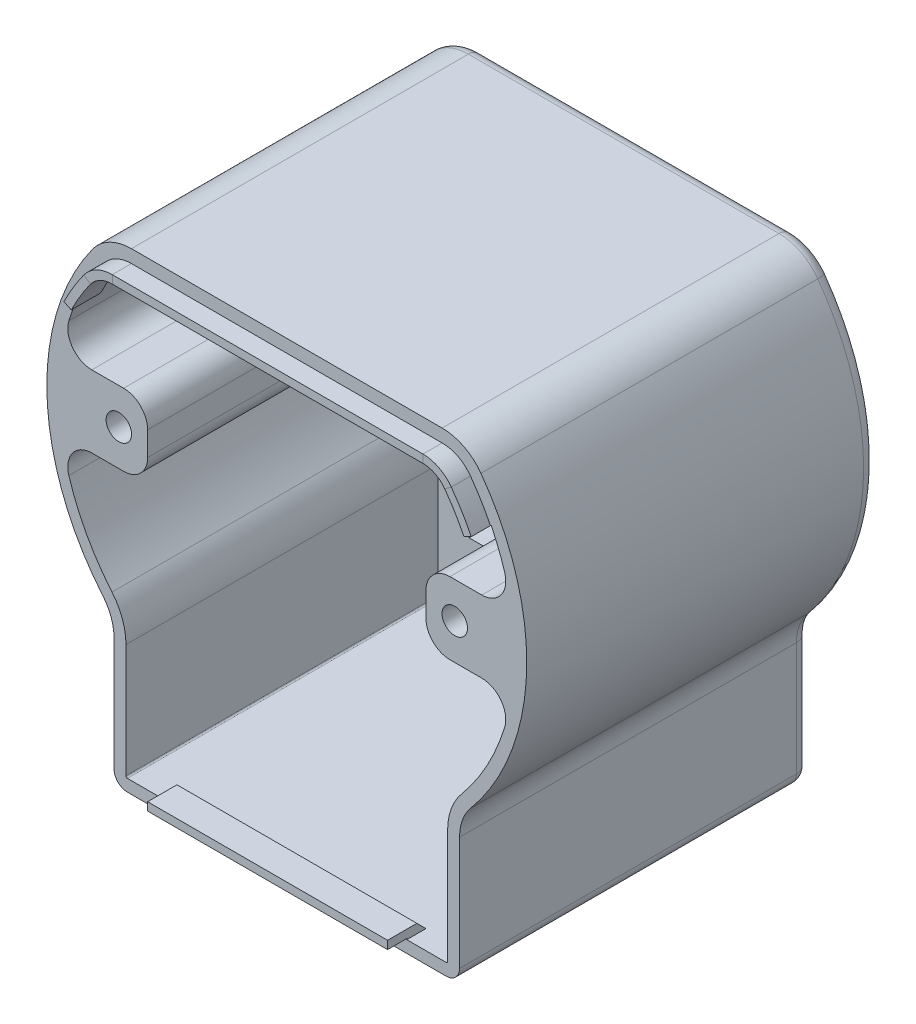
from build123d import *

# Parameters (mm, degrees)
LINEAR_AUSTRAGEN_D_NN1_DEPTH         = 65
AUFSATZ_LINEAR_START                 = 8
AUFSATZ_LINEAR_AUSTRAGEN2_DEPTH      = 8
AUFSATZ_LINEAR_AUSTRAGEN3_REACH      = 135.642
AUFSATZ_LINEAR_AUSTRAGEN3_END_RADIUS = 47.51
AUFSATZ_LINEAR_START_2               = 29
SKIZZE6_W                            = 65
SKIZZE6_H                            = 15
AUFSATZ_LINEAR_AUSTRAGEN4_REACH      = 135.642
AUFSATZ_LINEAR_START_3               = -29
SKIZZE6_2_W                          = 65
SKIZZE6_2_H                          = 15
SCHNITT_LINEAR_AUSTRAGEN2_REACH      = 111.791
SKIZZE7_R                            = 2.65
SCHNITT_LINEAR_AUSTRAGEN3_REACH      = 116.791
SCHNITT_LINEAR_START                 = -5
SKIZZE8_R                            = 4.5
AUFSATZ_LINEAR_AUSTRAGEN6_DEPTH      = 25
VERRUNDUNG1_R                        = 5
VERRUNDUNG3_R                        = 2.8


with BuildPart() as part:
    # Skizze1 → Linear-Austragen-Dünn1 (new body)
    with BuildSketch(Plane.XY):
        with BuildLine():
            Line((-33.2, -65), (0, -65))
            Line((0, -65), (33.2, -65))
            ThreePointArc((33.2, -65), (35.179898987, -64.179898987), (36, -62.2))
            Line((36, -62.2), (36, -38.522720569))
            ThreePointArc((36, -38.522720569), (36.601418547, -35.107070313), (38.333333333, -32.10226714))
            ThreePointArc((38.333333333, -32.10226714), (49.970076451, -1.729583607), (40.461208274, 29.375))
            ThreePointArc((40.461208274, 29.375), (36.91044215, 32.409264841), (32.368966619, 33.5))
            Line((32.368966619, 33.5), (0, 33.5))
            Line((0, 33.5), (-32.368966619, 33.5))
            ThreePointArc((-32.368966619, 33.5), (-36.91044215, 32.409264841), (-40.461208274, 29.375))
            ThreePointArc((-40.461208274, 29.375), (-49.970076451, -1.729583607), (-38.333333333, -32.10226714))
            ThreePointArc((-38.333333333, -32.10226714), (-36.601418547, -35.107070313), (-36, -38.522720569))
            Line((-36, -38.522720569), (-36, -62.2))
            ThreePointArc((-36, -62.2), (-35.179898987, -64.179898987), (-33.2, -65))
        make_face()
        with BuildLine():
            Line((-33.2, -62.51), (0, -62.51))
            Line((0, -62.51), (33.2, -62.51))
            ThreePointArc((33.2, -62.51), (33.419203102, -62.419203102), (33.51, -62.2))
            Line((33.51, -62.2), (33.51, -38.522720569))
            ThreePointArc((33.51, -38.522720569), (34.261171765, -34.2565734), (36.424333333, -30.503574237))
            ThreePointArc((36.424333333, -30.503574237), (47.481566644, -1.643450344), (38.446240102, 27.912125))
            ThreePointArc((38.446240102, 27.912125), (35.779614743, 30.190857895), (32.368966619, 31.01))
            Line((32.368966619, 31.01), (0, 31.01))
            Line((0, 31.01), (-32.368966619, 31.01))
            ThreePointArc((-32.368966619, 31.01), (-35.779614743, 30.190857895), (-38.446240102, 27.912125))
            ThreePointArc((-38.446240102, 27.912125), (-47.481566644, -1.643450344), (-36.424333333, -30.503574237))
            ThreePointArc((-36.424333333, -30.503574237), (-34.261171765, -34.2565734), (-33.51, -38.522720569))
            Line((-33.51, -38.522720569), (-33.51, -62.2))
            ThreePointArc((-33.51, -62.2), (-33.419203102, -62.419203102), (-33.2, -62.51))
        make_face(mode=Mode.SUBTRACT)
    extrude(amount=LINEAR_AUSTRAGEN_D_NN1_DEPTH)

    # Skizze3 → Aufsatz-Linear austragen2 (add)
    # profile 1 of 2: a face of its own
    with BuildSketch(Plane(origin=(0, 0, 0), x_dir=(-1, 0, 0), z_dir=(0, 0, -1)).offset(AUFSATZ_LINEAR_START)):
        with BuildLine():
            ThreePointArc((40.461208274, 29.375), (36.91044215, 32.409264841), (32.368966619, 33.5))
            Line((32.368966619, 33.5), (-32.368966619, 33.5))
            ThreePointArc((-32.368966619, 33.5), (-36.91044215, 32.409264841), (-40.461208274, 29.375))
            ThreePointArc((-40.461208274, 29.375), (-49.970076451, -1.729583607), (-38.333333333, -32.10226714))
            ThreePointArc((-38.333333333, -32.10226714), (-36.601418547, -35.107070313), (-36, -38.522720569))
            Line((-36, -38.522720569), (-36, -62.2))
            ThreePointArc((-36, -62.2), (-35.179898987, -64.179898987), (-33.2, -65))
            Line((-33.2, -65), (33.2, -65))
            ThreePointArc((33.2, -65), (35.179898987, -64.179898987), (36, -62.2))
            Line((36, -62.2), (36, -38.522720569))
            ThreePointArc((36, -38.522720569), (36.601418547, -35.107070313), (38.333333333, -32.10226714))
            ThreePointArc((38.333333333, -32.10226714), (49.970076451, -1.729583607), (40.461208274, 29.375))
        make_face()
        with BuildLine():
            ThreePointArc((-38.446240102, 27.912125), (-35.779614743, 30.190857895), (-32.368966619, 31.01))
            Line((-32.368966619, 31.01), (32.368966619, 31.01))
            ThreePointArc((32.368966619, 31.01), (35.779614743, 30.190857895), (38.446240102, 27.912125))
            ThreePointArc((38.446240102, 27.912125), (47.481566644, -1.643450344), (36.424333333, -30.503574237))
            ThreePointArc((36.424333333, -30.503574237), (34.261171765, -34.2565734), (33.51, -38.522720569))
            Line((33.51, -38.522720569), (33.51, -62.2))
            ThreePointArc((33.51, -62.2), (33.419203102, -62.419203102), (33.2, -62.51))
            Line((33.2, -62.51), (-33.2, -62.51))
            ThreePointArc((-33.2, -62.51), (-33.419203102, -62.419203102), (-33.51, -62.2))
            Line((-33.51, -62.2), (-33.51, -38.522720569))
            ThreePointArc((-33.51, -38.522720569), (-34.261171765, -34.2565734), (-36.424333333, -30.503574237))
            ThreePointArc((-36.424333333, -30.503574237), (-47.481566644, -1.643450344), (-38.446240102, 27.912125))
        make_face(mode=Mode.SUBTRACT)
    # profile 2 of 2: a face of its own
    with BuildSketch(Plane(origin=(0, 0, 0), x_dir=(-1, 0, 0), z_dir=(0, 0, -1)).offset(AUFSATZ_LINEAR_START)):
        with BuildLine():
            Line((32.368966619, 31.01), (-32.368966619, 31.01))
            ThreePointArc((-32.368966619, 31.01), (-35.779614743, 30.190857895), (-38.446240102, 27.912125))
            ThreePointArc((-38.446240102, 27.912125), (-47.481566644, -1.643450344), (-36.424333333, -30.503574237))
            ThreePointArc((-36.424333333, -30.503574237), (-34.261171765, -34.2565734), (-33.51, -38.522720569))
            Line((-33.51, -38.522720569), (-33.51, -62.2))
            ThreePointArc((-33.51, -62.2), (-33.419203102, -62.419203102), (-33.2, -62.51))
            Line((-33.2, -62.51), (33.2, -62.51))
            ThreePointArc((33.2, -62.51), (33.419203102, -62.419203102), (33.51, -62.2))
            Line((33.51, -62.2), (33.51, -38.522720569))
            ThreePointArc((33.51, -38.522720569), (34.261171765, -34.2565734), (36.424333333, -30.503574237))
            ThreePointArc((36.424333333, -30.503574237), (47.481566644, -1.643450344), (38.446240102, 27.912125))
            ThreePointArc((38.446240102, 27.912125), (35.779614743, 30.190857895), (32.368966619, 31.01))
        make_face()
        Polygon((-27, -29.5), (-29.5, -29.5), (-29.5, 29.5), (29.5, 29.5), (29.5, -29.5), (27, -29.5), (27, -48.5), (-27, -48.5), align=None, mode=Mode.SUBTRACT)
    extrude(amount=-AUFSATZ_LINEAR_AUSTRAGEN2_DEPTH)

    # Aufsatz-Linear austragen3: up to this cylinder (the profile starts inside it)
    aufsatz_linear_austragen3_end = Plane(origin=(0, 0, 32.5), z_dir=(0, 0, -1)) * Cylinder(AUFSATZ_LINEAR_AUSTRAGEN3_END_RADIUS, 367.304, mode=Mode.PRIVATE)
    # Skizze6 → Aufsatz-Linear austragen3 (add, up to the surface)
    with BuildSketch(Plane(origin=(0, 0, 0), x_dir=(0, 0, -1), z_dir=(1, 0, 0)).offset(AUFSATZ_LINEAR_START_2), mode=Mode.PRIVATE) as aufsatz_linear_austragen3_sk1:
        with Locations((-32.5, 0)):
            Rectangle(SKIZZE6_W, SKIZZE6_H)
    aufsatz_linear_austragen3_tool1 = extrude(aufsatz_linear_austragen3_sk1.sketch, amount=AUFSATZ_LINEAR_AUSTRAGEN3_REACH, mode=Mode.PRIVATE) & aufsatz_linear_austragen3_end
    add(aufsatz_linear_austragen3_tool1.solids().sort_by_distance((29, 0, 32.5))[0])

    # Skizze6<2> → Aufsatz-Linear austragen4 (add, up to next)
    with BuildSketch(Plane(origin=(0, 0, 0), x_dir=(0, 0, -1), z_dir=(1, 0, 0)).offset(AUFSATZ_LINEAR_START_3), mode=Mode.PRIVATE) as aufsatz_linear_austragen4_sk1:
        with Locations((-32.5, 0)):
            Rectangle(SKIZZE6_2_W, SKIZZE6_2_H)
    aufsatz_linear_austragen4_tool1 = extrude(aufsatz_linear_austragen4_sk1.sketch, amount=-AUFSATZ_LINEAR_AUSTRAGEN4_REACH, mode=Mode.PRIVATE) - part.part
    add(aufsatz_linear_austragen4_tool1.solids().sort_by_distance((-29, 0, 32.5))[0])

    # Skizze7 → Schnitt-Linear austragen2 (cut, up to next)
    with BuildSketch(Plane.XY.offset(65), mode=Mode.PRIVATE) as schnitt_linear_austragen2_sk1:
        with Locations((-35, 0)):
            Circle(SKIZZE7_R)
    schnitt_linear_austragen2_tool1 = extrude(schnitt_linear_austragen2_sk1.sketch, amount=-SCHNITT_LINEAR_AUSTRAGEN2_REACH, mode=Mode.PRIVATE) & part.part
    # Skizze7 → Schnitt-Linear austragen2 (cut, up to next)
    with BuildSketch(Plane.XY.offset(65), mode=Mode.PRIVATE) as schnitt_linear_austragen2_sk2:
        with Locations(Location((35, 0, 0), (0, 0, 180))):
            Circle(SKIZZE7_R)
    schnitt_linear_austragen2_tool2 = extrude(schnitt_linear_austragen2_sk2.sketch, amount=-SCHNITT_LINEAR_AUSTRAGEN2_REACH, mode=Mode.PRIVATE) & part.part
    add(schnitt_linear_austragen2_tool1.solids().sort_by_distance((-35, 0, 65))[0], mode=Mode.SUBTRACT)
    add(schnitt_linear_austragen2_tool2.solids().sort_by_distance((35, 0, 65))[0], mode=Mode.SUBTRACT)

    # Skizze8 → Schnitt-Linear austragen3 (cut, up to next)
    with BuildSketch(Plane.XY.offset(65).offset(SCHNITT_LINEAR_START), mode=Mode.PRIVATE) as schnitt_linear_austragen3_sk1:
        with Locations((-35, 0)):
            Circle(SKIZZE8_R)
    schnitt_linear_austragen3_tool1 = extrude(schnitt_linear_austragen3_sk1.sketch, amount=-SCHNITT_LINEAR_AUSTRAGEN3_REACH, mode=Mode.PRIVATE) & part.part
    # Skizze8 → Schnitt-Linear austragen3 (cut, up to next)
    with BuildSketch(Plane.XY.offset(65).offset(SCHNITT_LINEAR_START), mode=Mode.PRIVATE) as schnitt_linear_austragen3_sk2:
        with Locations((35, 0)):
            Circle(SKIZZE8_R)
    schnitt_linear_austragen3_tool2 = extrude(schnitt_linear_austragen3_sk2.sketch, amount=-SCHNITT_LINEAR_AUSTRAGEN3_REACH, mode=Mode.PRIVATE) & part.part
    add(schnitt_linear_austragen3_tool1.solids().sort_by_distance((-35, 0, 60))[0], mode=Mode.SUBTRACT)
    add(schnitt_linear_austragen3_tool2.solids().sort_by_distance((35, 0, 60))[0], mode=Mode.SUBTRACT)

    # Austragung12: sweep along a path in Skizze10
    with BuildLine(Plane.XY.offset(65)) as austragung12_path:
        ThreePointArc((-42.611970149, 21.01), (-40.675769134, 24.549580553), (-38.446240102, 27.912125))
        ThreePointArc((-38.446240102, 27.912125), (-35.779614743, 30.190857895), (-32.368966619, 31.01))
        Line((-32.368966619, 31.01), (32.368966619, 31.01))
        ThreePointArc((32.368966619, 31.01), (35.779614743, 30.190857895), (38.446240102, 27.912125))
        ThreePointArc((38.446240102, 27.912125), (40.675769134, 24.549580553), (42.611970149, 21.01))
    # Skizze9 → Austragung12 (sweep)
    with BuildSketch(Plane(origin=(0, 0, 0), x_dir=(0, 0, -1), z_dir=(1, 0, 0))):
        Polygon((-65, 31.01), (-65, 30.81), (-69, 30.81), (-69, 29.12), (-62.89, 29.12), (-60, 32.01), (-65, 32.01), align=None)
    sweep(path=austragung12_path.line)

    # Skizze9<4> → Aufsatz-Linear austragen6 (add, symmetric)
    with BuildSketch(Plane(origin=(0, 0, 0), x_dir=(0, 0, -1), z_dir=(1, 0, 0))):
        Polygon((-65, -63.51), (-60, -63.51), (-62.89, -60.62), (-69, -60.62), (-69, -62.31), (-65, -62.31), (-65, -62.51), align=None)
    extrude(amount=AUFSATZ_LINEAR_AUSTRAGEN6_DEPTH, both=True)

    # Verrundung1
    # the kernel refuses this fillet: 5 mm, written as the material it adds along each edge
    with BuildSketch(Plane(origin=(46.914284605, 7.5, 65), x_dir=(-1, 0, 0), z_dir=(0, 0, -1)), Plane(origin=(-46.914284605, -7.5, 65), x_dir=(1, 0, 0), z_dir=(0, 0, -1))) as verrundung1_piece_1:
        with BuildLine():
            CenterArc((6.283629922, 5), VERRUNDUNG1_R, 162.899512403, 107.100487597)
            ThreePointArc((1.504677359, 6.470242296), (0.639115665, 3.261451554), (0, 0))
            Line((0, 0), (6.283629922, 0))
        make_face()
    extrude(amount=65)
    with BuildSketch(Plane(origin=(46.914284605, -7.5, 65), x_dir=(-0.22650918867747508, -0.9740090284205132, 0), z_dir=(0, 0, -1)), Plane(origin=(-46.914284605, 7.5, 65), x_dir=(0.2265091886774727, 0.9740090284205137, 0), z_dir=(0, 0, -1))) as verrundung1_piece_2:
        with BuildLine():
            CenterArc((6.293345058, 4.987766332), VERRUNDUNG1_R, 166.908360234, 107.100487597)
            Line((1.423299915, 6.120312275), (0, 0))
            ThreePointArc((0, 0), (3.32144883, -0.116244318), (6.64289766, 0))
        make_face()
    extrude(amount=65)
    # the kernel refuses this fillet: 5 mm, written as the material it takes off along each edge
    with BuildSketch(Plane(origin=(29, 7.5, 77.5), x_dir=(1, 0, 0), z_dir=(0, 0, -1)), Plane(origin=(-29, 7.5, 77.5), x_dir=(0, -1, 0), z_dir=(0, 0, -1))) as verrundung1_2_piece_1:
        with BuildLine():
            CenterArc((VERRUNDUNG1_R, VERRUNDUNG1_R), VERRUNDUNG1_R, 180, 90)
            Line((0, VERRUNDUNG1_R), (0, 0))
            Line((0, 0), (VERRUNDUNG1_R, 0))
        make_face()
    extrude(amount=77.5, mode=Mode.SUBTRACT)
    with BuildSketch(Plane(origin=(29, -7.5, 0), x_dir=(0, 1, 0), z_dir=(0, 0, 1)), Plane(origin=(-29, -7.5, 0), x_dir=(-1, 0, 0), z_dir=(0, 0, 1))) as verrundung1_2_piece_2:
        with BuildLine():
            CenterArc((VERRUNDUNG1_R, -VERRUNDUNG1_R), VERRUNDUNG1_R, 90, 90)
            Line((0, -VERRUNDUNG1_R), (0, 0))
            Line((0, 0), (VERRUNDUNG1_R, 0))
        make_face()
    extrude(amount=77.5, mode=Mode.SUBTRACT)

    # Verrundung3
    verrundung3_edges = [part.edges().sort_by_distance(p)[0] for p in [
        (-36.91044215, 32.409264841, -8),
        (0, 33.5, -8),
        (36.91044215, 32.409264841, -8),
        (49.970076451, -1.729583607, -8),
        (36.601418547, -35.107070313, -8),
        (36, -50.361360284, -8),
        (35.179898987, -64.179898987, -8),
        (0, -65, -8),
        (-35.179898987, -64.179898987, -8),
        (-36, -50.361360284, -8),
        (-36.601418547, -35.107070313, -8),
        (-49.970076451, -1.729583607, -8),
    ]]
    fillet(verrundung3_edges, radius=VERRUNDUNG3_R)


solid = part.part
